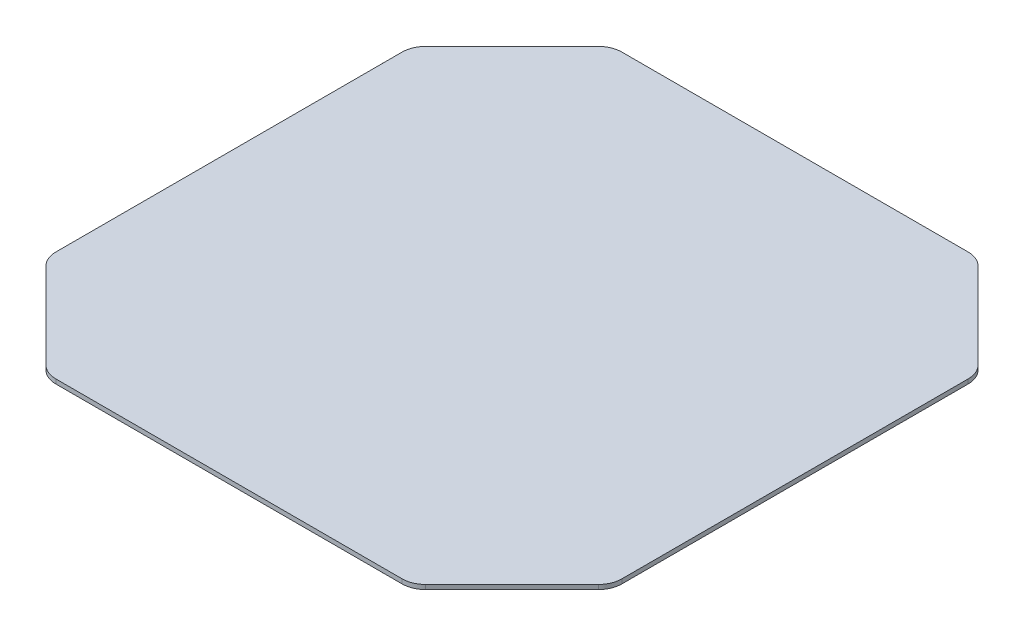
from build123d import *

# Parameters (mm, degrees)
SKETCH1_W            = 1219.2
SKETCH1_H            = 1219.2
BOSS_EXTRUDE1_DEPTH  = 9.525
CUT_EXTRUDE1_REACH   = 864.157
SKETCH2_R            = 152.4
CUT_EXTRUDE2_DEPTH   = 863.157204705
MIRROR2_COPY_1_DEPTH = 863.157204705
FILLET1_R            = 50.8


with BuildPart() as part:
    # Sketch1 → Boss-Extrude1 (new body)
    with BuildSketch(Plane(origin=(0, 0, 0), x_dir=(1, 0, 0), z_dir=(0, 1, 0))):
        Rectangle(SKETCH1_W, SKETCH1_H)
    extrude(amount=BOSS_EXTRUDE1_DEPTH)

    # Sketch2 → Cut-Extrude1 (cut, up to next)
    with BuildSketch(Plane(origin=(0, 9.525, 0), x_dir=(1, 0, 0), z_dir=(0, 1, 0)), mode=Mode.PRIVATE) as cut_extrude1_sk1:
        with Locations((-609.6, 609.6)):
            Circle(SKETCH2_R)
    cut_extrude1_tool1 = extrude(cut_extrude1_sk1.sketch, amount=-CUT_EXTRUDE1_REACH, mode=Mode.PRIVATE) & part.part
    # Sketch2 → Cut-Extrude1 (cut, up to next)
    with BuildSketch(Plane(origin=(0, 9.525, 0), x_dir=(1, 0, 0), z_dir=(0, 1, 0)), mode=Mode.PRIVATE) as cut_extrude1_sk2:
        with Locations((-609.6, -609.6)):
            Circle(SKETCH2_R)
    cut_extrude1_tool2 = extrude(cut_extrude1_sk2.sketch, amount=-CUT_EXTRUDE1_REACH, mode=Mode.PRIVATE) & part.part
    # Sketch2 → Cut-Extrude1 (cut, up to next)
    with BuildSketch(Plane(origin=(0, 9.525, 0), x_dir=(1, 0, 0), z_dir=(0, 1, 0)), mode=Mode.PRIVATE) as cut_extrude1_sk3:
        with Locations((609.6, -609.6)):
            Circle(SKETCH2_R)
    cut_extrude1_tool3 = extrude(cut_extrude1_sk3.sketch, amount=-CUT_EXTRUDE1_REACH, mode=Mode.PRIVATE) & part.part
    # Sketch2 → Cut-Extrude1 (cut, up to next)
    with BuildSketch(Plane(origin=(0, 9.525, 0), x_dir=(1, 0, 0), z_dir=(0, 1, 0)), mode=Mode.PRIVATE) as cut_extrude1_sk4:
        with Locations((609.6, 609.6)):
            Circle(SKETCH2_R)
    cut_extrude1_tool4 = extrude(cut_extrude1_sk4.sketch, amount=-CUT_EXTRUDE1_REACH, mode=Mode.PRIVATE) & part.part
    add(cut_extrude1_tool1.solids().sort_by_distance((-609.6, 9.525, -609.6))[0], mode=Mode.SUBTRACT)
    add(cut_extrude1_tool2.solids().sort_by_distance((-609.6, 9.525, 609.6))[0], mode=Mode.SUBTRACT)
    add(cut_extrude1_tool3.solids().sort_by_distance((609.6, 9.525, 609.6))[0], mode=Mode.SUBTRACT)
    add(cut_extrude1_tool4.solids().sort_by_distance((609.6, 9.525, -609.6))[0], mode=Mode.SUBTRACT)

    # Sketch3 → Cut-Extrude2 (cut, symmetric)
    with BuildSketch(Plane(origin=(0, 9.525, 0), x_dir=(1, 0, 0), z_dir=(0, 1, 0))):
        Polygon((-1846.295154261, 2849.969007356), (394.073853094, 609.6), (609.6, 394.073853094), (2849.969007356, -1846.295154261), (7330.707022067, 2634.44286045), (2634.44286045, 7330.707022067), align=None)
    cut_extrude2 = extrude(amount=CUT_EXTRUDE2_DEPTH, both=True, mode=Mode.SUBTRACT)

    # Mirror1: Cut-Extrude2 across plane
    add(cut_extrude2.mirror(Plane.XY), mode=Mode.SUBTRACT)

    # Mirror2: Cut-Extrude2 across plane
    add(cut_extrude2.mirror(Plane(origin=(0, 0, 0), x_dir=(0, 0, 1), z_dir=(1, 0, 0))), mode=Mode.SUBTRACT)

    # Mirror2 copy 1 sketch → Mirror2 copy 1 (cut, symmetric)
    with BuildSketch(Plane(origin=(0, 9.525, 0), x_dir=(-1, 0, 0), z_dir=(0, 1, 0))):
        Polygon((-1846.295154261, 2849.969007356), (394.073853094, 609.6), (609.6, 394.073853094), (2849.969007356, -1846.295154261), (7330.707022067, 2634.44286045), (2634.44286045, 7330.707022067), align=None)
    extrude(amount=MIRROR2_COPY_1_DEPTH, both=True, mode=Mode.SUBTRACT)

    # Fillet1
    fillet1_edges = [part.edges().sort_by_distance(p)[0] for p in [
        (394.073853094, 4.7625, -609.6),
        (609.6, 4.7625, -394.073853094),
        (609.6, 4.7625, 394.073853094),
        (394.073853094, 4.7625, 609.6),
        (-394.073853094, 4.7625, 609.6),
        (-609.6, 4.7625, 394.073853094),
        (-394.073853094, 4.7625, -609.6),
        (-609.6, 4.7625, -394.073853094),
    ]]
    fillet(fillet1_edges, radius=FILLET1_R)


solid = part.part
